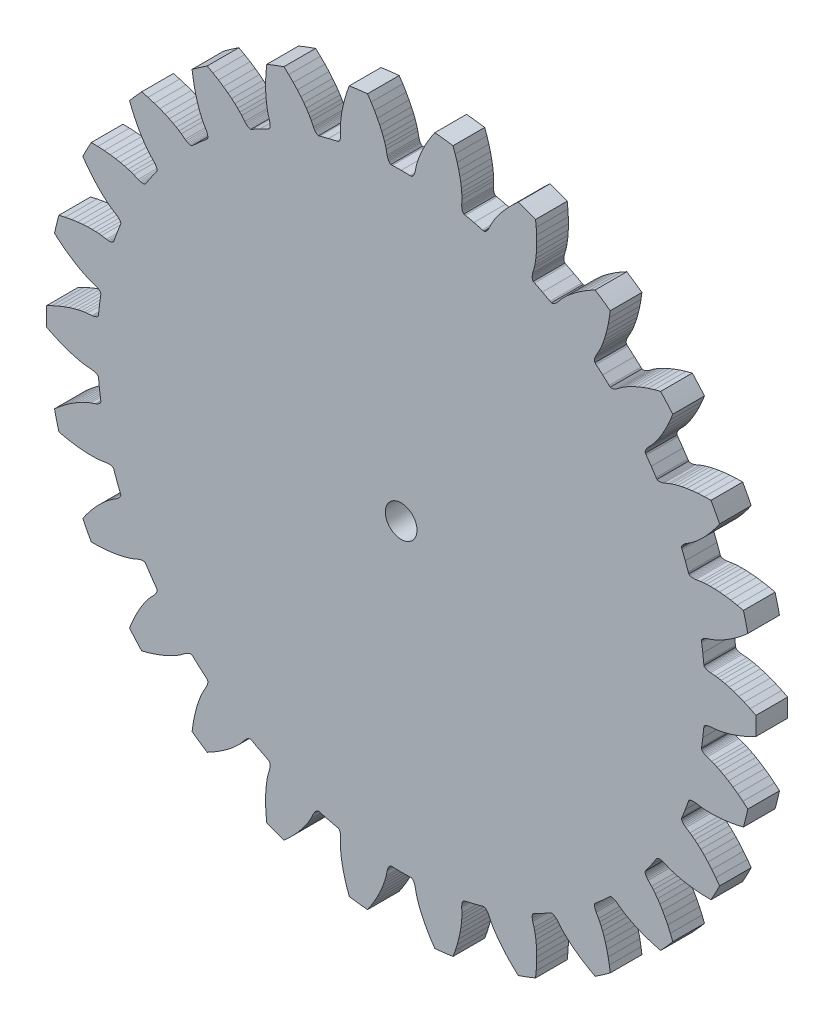
from build123d import *

# Parameters (mm, degrees)
MODEL_R             = 2.5
BOSS_EXTRUDE1_DEPTH = 5


with BuildPart() as part:
    # Model → Boss-Extrude1 (new body)
    with BuildSketch(Plane.XY):
        with BuildLine():
            Line((53.1145369, 10.6909188), (53.9185912, 11.3234084))
            Line((53.9185912, 11.3234084), (54.700837925, 11.992224127))
            ThreePointArc((54.700837925, 11.992224127), (54.372699629, 13.40166681), (54.00825103, 14.802159807))
            Line((54.00825103, 14.802159807), (53.0047917, 15.0308385))
            Line((53.0047917, 15.0308385), (51.9989045, 15.2172176))
            Line((51.9989045, 15.2172176), (51.0709493, 15.3492608))
            Line((51.0709493, 15.3492608), (50.2227788, 15.4339274))
            Line((50.2227788, 15.4339274), (49.4587592, 15.4780067))
            Line((49.4587592, 15.4780067), (48.7788318, 15.48876))
            Line((48.7788318, 15.48876), (48.184081, 15.4732826))
            Line((48.184081, 15.4732826), (47.6758858, 15.4387394))
            Line((47.6758858, 15.4387394), (47.2557344, 15.3924859))
            Line((47.2557344, 15.3924859), (46.5056239, 15.2698861))
            Line((46.5056239, 15.2698861), (46.2943856, 15.2490778))
            Line((46.2943856, 15.2490778), (46.1029098, 15.2433899))
            Line((46.1029098, 15.2433899), (45.9317238, 15.2519957))
            Line((45.9317238, 15.2519957), (45.7813225, 15.2740135))
            Line((45.7813225, 15.2740135), (45.652196, 15.3086023))
            Line((45.652196, 15.3086023), (45.544796, 15.3548533))
            Line((45.544796, 15.3548533), (45.4595411, 15.4118878))
            Line((45.4595411, 15.4118878), (45.3968175, 15.4787721))
            Line((45.3968175, 15.4787721), (45.3570103, 15.5546041))
            Line((45.3570103, 15.5546041), (45.3057091, 15.7038618))
            Line((45.3057091, 15.7038618), (44.8340288, 17.0033043))
            Line((44.8340288, 17.0033043), (44.3253968, 18.2887329))
            Line((44.3253968, 18.2887329), (44.2648202, 18.4344729))
            Line((44.2648202, 18.4344729), (44.2443304, 18.517631))
            Line((44.2443304, 18.517631), (44.2469271, 18.609288))
            Line((44.2469271, 18.609288), (44.2729204, 18.7085134))
            Line((44.2729204, 18.7085134), (44.3226405, 18.8143522))
            Line((44.3226405, 18.8143522), (44.3963564, 18.925869))
            Line((44.3963564, 18.925869), (44.4943329, 19.042084))
            Line((44.4943329, 19.042084), (44.6167607, 19.1620429))
            Line((44.6167607, 19.1620429), (44.7638542, 19.2847575))
            Line((44.7638542, 19.2847575), (44.9357668, 19.4092591))
            Line((44.9357668, 19.4092591), (45.5785313, 19.8149071))
            Line((45.5785313, 19.8149071), (45.9236908, 20.0588977))
            Line((45.9236908, 20.0588977), (46.3269868, 20.3700375))
            Line((46.3269868, 20.3700375), (46.7824276, 20.7528453))
            Line((46.7824276, 20.7528453), (47.2842298, 21.2117694))
            Line((47.2842298, 21.2117694), (47.8268767, 21.751402))
            Line((47.8268767, 21.751402), (48.4055971, 22.3772169))
            Line((48.4055971, 22.3772169), (49.0126207, 23.0914008))
            Line((49.0126207, 23.0914008), (49.6419459, 23.8979342))
            Line((49.6419459, 23.8979342), (50.241403889, 24.734519343))
            ThreePointArc((50.241403889, 24.734519343), (49.585498769, 26.024477381), (48.896480705, 27.297056406))
            Line((48.896480705, 27.297056406), (47.8674537, 27.2789466))
            Line((47.8674537, 27.2789466), (46.8461923, 27.2191853))
            Line((46.8461923, 27.2191853), (45.9136017, 27.1253174))
            Line((45.9136017, 27.1253174), (45.0698155, 27.0045432))
            Line((45.0698155, 27.0045432), (44.3174481, 26.8644998))
            Line((44.3174481, 26.8644998), (43.6547047, 26.7122233))
            Line((43.6547047, 26.7122233), (43.0809402, 26.5548625))
            Line((43.0809402, 26.5548625), (42.595779, 26.3997039))
            Line((42.595779, 26.3997039), (42.1989057, 26.2542458))
            Line((42.1989057, 26.2542458), (41.4999321, 25.9556952))
            Line((41.4999321, 25.9556952), (41.2998117, 25.8849389))
            Line((41.2998117, 25.8849389), (41.115261, 25.8335931))
            Line((41.115261, 25.8335931), (40.9469899, 25.8009814))
            Line((40.9469899, 25.8009814), (40.7956898, 25.786366))
            Line((40.7956898, 25.786366), (40.6620379, 25.7890478))
            Line((40.6620379, 25.7890478), (40.54669, 25.8082523))
            Line((40.54669, 25.8082523), (40.4502632, 25.8432266))
            Line((40.4502632, 25.8432266), (40.3733559, 25.8931567))
            Line((40.3733559, 25.8931567), (40.3165576, 25.9572587))
            Line((40.3165576, 25.9572587), (40.2310274, 26.089902))
            Line((40.2310274, 26.089902), (39.4620764, 27.2387046))
            Line((39.4620764, 27.2387046), (38.660601, 28.3650573))
            Line((38.660601, 28.3650573), (38.5669068, 28.4920654))
            Line((38.5669068, 28.4920654), (38.5271114, 28.5679036))
            Line((38.5271114, 28.5679036), (38.5076977, 28.6575187))
            Line((38.5076977, 28.6575187), (38.5091895, 28.7600814))
            Line((38.5091895, 28.7600814), (38.5321359, 28.8747435))
            Line((38.5321359, 28.8747435), (38.5770221, 29.0006612))
            Line((38.5770221, 29.0006612), (38.6443394, 29.1369465))
            Line((38.6443394, 29.1369465), (38.7345017, 29.2827185))
            Line((38.7345017, 29.2827185), (38.8479534, 29.437069))
            Line((38.8479534, 29.437069), (38.9850754, 29.5990942))
            Line((38.9850754, 29.5990942), (39.5120844, 30.1467784))
            Line((39.5120844, 30.1467784), (39.7888234, 30.4662812))
            Line((39.7888234, 30.4662812), (40.1059397, 30.8648949))
            Line((40.1059397, 30.8648949), (40.4565343, 31.3455731))
            Line((40.4565343, 31.3455731), (40.8339273, 31.9112508))
            Line((40.8339273, 31.9112508), (41.2316633, 32.5650666))
            Line((41.2316633, 32.5650666), (41.6437999, 33.3111933))
            Line((41.6437999, 33.3111933), (42.0622691, 34.1498945))
            Line((42.0622691, 34.1498945), (42.4802912, 35.0835989))
            Line((42.4802912, 35.0835989), (42.86212209, 36.03933398))
            ThreePointArc((42.86212209, 36.03933398), (41.916568958, 37.13483965), (40.943024605, 38.205547261))
            Line((40.943024605, 38.205547261), (39.9482332, 37.9417015))
            Line((39.9482332, 37.9417015), (38.9709496, 37.6392729))
            Line((38.9709496, 37.6392729), (38.0879226, 37.324949))
            Line((38.0879226, 37.324949), (37.2975584, 37.0057531))
            Line((37.2975584, 37.0057531), (36.6005679, 36.6897258))
            Line((36.6005679, 36.6897258), (35.9935249, 36.3832693))
            Line((35.9935249, 36.3832693), (35.4740919, 36.0931703))
            Line((35.4740919, 36.0931703), (35.0401604, 35.8264137))
            Line((35.0401604, 35.8264137), (34.6896299, 35.5902042))
            Line((34.6896299, 35.5902042), (34.082415, 35.1330537))
            Line((34.082415, 35.1330537), (33.9050429, 35.0164615))
            Line((33.9050429, 35.0164615), (33.7381428, 34.9224419))
            Line((33.7381428, 34.9224419), (33.5825658, 34.8505079))
            Line((33.5825658, 34.8505079), (33.4391599, 34.8001087))
            Line((33.4391599, 34.8001087), (33.3087498, 34.7707275))
            Line((33.3087498, 34.7707275), (33.1921579, 34.7617694))
            Line((33.1921579, 34.7617694), (33.0901632, 34.772651))
            Line((33.0901632, 34.772651), (33.0035415, 34.8027251))
            Line((33.0035415, 34.8027251), (32.9330531, 34.8513717))
            Line((32.9330531, 34.8513717), (32.8182646, 34.9596919))
            Line((32.8182646, 34.9596919), (31.7967315, 35.8910904))
            Line((31.7967315, 35.8910904), (30.7489917, 36.7929077))
            Line((30.7489917, 36.7929077), (30.627625, 36.8938027))
            Line((30.627625, 36.8938027), (30.5708367, 36.9579135))
            Line((30.5708367, 36.9579135), (30.5305408, 37.0402785))
            Line((30.5305408, 37.0402785), (30.5074444, 37.140218))
            Line((30.5074444, 37.140218), (30.5022836, 37.2570396))
            Line((30.5022836, 37.2570396), (30.5157314, 37.3900403))
            Line((30.5157314, 37.3900403), (30.5484774, 37.5384756))
            Line((30.5484774, 37.5384756), (30.6011342, 37.7015889))
            Line((30.6011342, 37.7015889), (30.6743508, 37.878605))
            Line((30.6743508, 37.878605), (30.7687131, 38.0687375))
            Line((30.7687131, 38.0687375), (31.1493387, 38.7266285))
            Line((31.1493387, 38.7266285), (31.3415742, 39.1030751))
            Line((31.3415742, 39.1030751), (31.5540812, 39.5659967))
            Line((31.5540812, 39.5659967), (31.7794543, 40.1166101))
            Line((31.7794543, 40.1166101), (32.0105054, 40.7561663))
            Line((32.0105054, 40.7561663), (32.2402156, 41.4861678))
            Line((32.2402156, 41.4861678), (32.4618164, 42.3092442))
            Line((32.4618164, 42.3092442), (32.6674113, 43.2237205))
            Line((32.6674113, 43.2237205), (32.8498364, 44.2303324))
            Line((32.8498364, 44.2303324), (32.991849572, 45.249673828))
            ThreePointArc((32.991849572, 45.249673828), (31.81160102, 46.087060609), (30.610108842, 46.893670685))
            Line((30.610108842, 46.893670685), (29.7073667, 46.3994226))
            Line((29.7073667, 46.3994226), (28.8308571, 45.8719027))
            Line((28.8308571, 45.8719027), (28.0487118, 45.3553904))
            Line((28.0487118, 45.3553904), (27.3577028, 44.8563231))
            Line((27.3577028, 44.8563231), (26.7565959, 44.3826783))
            Line((26.7565959, 44.3826783), (26.2405322, 43.9398519))
            Line((26.2405322, 43.9398519), (25.8056182, 43.5338742))
            Line((25.8056182, 43.5338742), (25.448135, 43.1710225))
            Line((25.448135, 43.1710225), (25.1643189, 42.8577894))
            Line((25.1643189, 42.8577894), (24.6841519, 42.2686068))
            Line((24.6841519, 42.2686068), (24.5398362, 42.1129547))
            Line((24.5398362, 42.1129547), (24.4002863, 41.9817252))
            Line((24.4002863, 41.9817252), (24.266445, 41.8746495))
            Line((24.266445, 41.8746495), (24.1392675, 41.7913956))
            Line((24.1392675, 41.7913956), (24.0196783, 41.731659))
            Line((24.0196783, 41.731659), (23.9086182, 41.6950589))
            Line((23.9086182, 41.6950589), (23.8069831, 41.6812154))
            Line((23.8069831, 41.6812154), (23.7156813, 41.6896856))
            Line((23.7156813, 41.6896856), (23.6355993, 41.7200496))
            Line((23.6355993, 41.7200496), (23.4982236, 41.7977516))
            Line((23.4982236, 41.7977516), (22.2834761, 42.4576164))
            Line((22.2834761, 42.4576164), (21.0503627, 43.0824881))
            Line((21.0503627, 43.0824881), (20.908377, 43.1514063))
            Line((20.908377, 43.1514063), (20.8378961, 43.2000638))
            Line((20.8378961, 43.2000638), (20.7790599, 43.270392))
            Line((20.7790599, 43.270392), (20.7327176, 43.3619001))
            Line((20.7327176, 43.3619001), (20.6997495, 43.474092))
            Line((20.6997495, 43.474092), (20.6809774, 43.6064463))
            Line((20.6809774, 43.6064463), (20.677249, 43.7584049))
            Line((20.677249, 43.7584049), (20.6893401, 43.92938))
            Line((20.6893401, 43.92938), (20.7180664, 44.1187742))
            Line((20.7180664, 44.1187742), (20.764185, 44.3259642))
            Line((20.764185, 44.3259642), (20.9763067, 45.0558278))
            Line((20.9763067, 45.0558278), (21.0728666, 45.4673405))
            Line((21.0728666, 45.4673405), (21.1684141, 45.9676667))
            Line((21.1684141, 45.9676667), (21.2554679, 46.5562155))
            Line((21.2554679, 46.5562155), (21.3267493, 47.2324816))
            Line((21.3267493, 47.2324816), (21.3750837, 47.9962438))
            Line((21.3750837, 47.9962438), (21.3932701, 48.8484356))
            Line((21.3932701, 48.8484356), (21.3740423, 49.785541))
            Line((21.3740423, 49.785541), (21.3102684, 50.8065597))
            Line((21.3102684, 50.8065597), (21.20421064, 51.830266876))
            ThreePointArc((21.20421064, 51.830266876), (19.857858064, 52.360868552), (18.498244695, 52.856504393))
            Line((18.498244695, 52.856504393), (17.740016, 52.1605779))
            Line((17.740016, 52.1605779), (17.0152199, 51.4386243))
            Line((17.0152199, 51.4386243), (16.3794118, 50.7499412))
            Line((16.3794118, 50.7499412), (15.8279169, 50.1000067))
            Line((15.8279169, 50.1000067), (15.3576277, 49.4962708))
            Line((15.3576277, 49.4962708), (14.9625352, 48.9428101))
            Line((14.9625352, 48.9428101), (14.6374158, 48.4445476))
            Line((14.6374158, 48.4445476), (14.3771566, 48.0066883))
            Line((14.3771566, 48.0066883), (14.1765492, 47.6346356))
            Line((14.1765492, 47.6346356), (13.8513356, 46.9476622))
            Line((13.8513356, 46.9476622), (13.7484635, 46.7619959))
            Line((13.7484635, 46.7619959), (13.6443738, 46.6011833))
            Line((13.6443738, 46.6011833), (13.5400466, 46.4651887))
            Line((13.5400466, 46.4651887), (13.4364887, 46.3539184))
            Line((13.4364887, 46.3539184), (13.3346705, 46.2672981))
            Line((13.3346705, 46.2672981), (13.2355965, 46.2051831))
            Line((13.2355965, 46.2051831), (13.1402277, 46.167419))
            Line((13.1402277, 46.167419), (13.0495519, 46.1537932))
            Line((13.0495519, 46.1537932), (12.9645303, 46.1641099))
            Line((12.9645303, 46.1641099), (12.8125513, 46.2066779))
            Line((12.8125513, 46.2066779), (11.4751861, 46.5566601))
            Line((11.4751861, 46.5566601), (10.1283632, 46.8682708))
            Line((10.1283632, 46.8682708), (9.9740101, 46.901207))
            Line((9.9740101, 46.901207), (9.8939328, 46.9315834))
            Line((9.8939328, 46.9315834), (9.8199756, 46.9857876))
            Line((9.8199756, 46.9857876), (9.7530806, 47.0635462))
            Line((9.7530806, 47.0635462), (9.6942212, 47.1645882))
            Line((9.6942212, 47.1645882), (9.6443201, 47.288604))
            Line((9.6443201, 47.288604), (9.604334, 47.4352547))
            Line((9.604334, 47.4352547), (9.5751567, 47.6041553))
            Line((9.5751567, 47.6041553), (9.5577233, 47.7949206))
            Line((9.5577233, 47.7949206), (9.5529179, 48.007127))
            Line((9.5529179, 48.007127), (9.584208, 48.7665461))
            Line((9.584208, 48.7665461), (9.5794806, 49.1892093))
            Line((9.5794806, 49.1892093), (9.5525158, 49.6978629))
            Line((9.5525158, 49.6978629), (9.496191, 50.2901429))
            Line((9.496191, 50.2901429), (9.40356, 50.9638167))
            Line((9.40356, 50.9638167), (9.2677097, 51.7169526))
            Line((9.2677097, 51.7169526), (9.0814248, 52.5487335))
            Line((9.0814248, 52.5487335), (8.8384916, 53.4540068))
            Line((8.8384916, 53.4540068), (8.5322252, 54.4300945))
            Line((8.5322252, 54.4300945), (8.184260089, 55.398673248))
            ThreePointArc((8.184260089, 55.398673248), (6.750048811, 55.591653611), (5.311329885, 55.747510147))
            Line((5.311329885, 55.747510147), (4.74168, 54.89035))
            Line((4.74168, 54.89035), (4.21072, 54.01592))
            Line((4.21072, 54.01592), (3.7582, 53.19509))
            Line((3.7582, 53.19509), (3.37827, 52.43206))
            Line((3.37827, 52.43206), (3.06613, 51.73332))
            Line((3.06613, 51.73332), (2.81497, 51.10139))
            Line((2.81497, 51.10139), (2.61854, 50.5398))
            Line((2.61854, 50.5398), (2.47063, 50.05238))
            Line((2.47063, 50.05238), (2.36489, 49.64313))
            Line((2.36489, 49.64313), (2.21353, 48.89829))
            Line((2.21353, 48.89829), (2.15808, 48.6934))
            Line((2.15808, 48.6934), (2.0955, 48.51235))
            Line((2.0955, 48.51235), (2.02675, 48.35534))
            Line((2.02675, 48.35534), (1.95283, 48.22252))
            Line((1.95283, 48.22252), (1.8747, 48.11405))
            Line((1.8747, 48.11405), (1.79337, 48.03003))
            Line((1.79337, 48.03003), (1.70981, 47.97054))
            Line((1.70981, 47.97054), (1.62503, 47.93561))
            Line((1.62503, 47.93561), (1.54001, 47.92528))
            Line((1.54001, 47.92528), (1.38226, 47.93024))
            Line((1.38226, 47.93024), (0, 47.95))
            Line((0, 47.95), (-1.38226, 47.93024))
            Line((-1.38226, 47.93024), (-1.54001, 47.92528))
            Line((-1.54001, 47.92528), (-1.62503, 47.93561))
            Line((-1.62503, 47.93561), (-1.70981, 47.97054))
            Line((-1.70981, 47.97054), (-1.79337, 48.03003))
            Line((-1.79337, 48.03003), (-1.8747, 48.11405))
            Line((-1.8747, 48.11405), (-1.95283, 48.22252))
            Line((-1.95283, 48.22252), (-2.02675, 48.35534))
            Line((-2.02675, 48.35534), (-2.0955, 48.51235))
            Line((-2.0955, 48.51235), (-2.15808, 48.6934))
            Line((-2.15808, 48.6934), (-2.21353, 48.89829))
            Line((-2.21353, 48.89829), (-2.36489, 49.64313))
            Line((-2.36489, 49.64313), (-2.47063, 50.05238))
            Line((-2.47063, 50.05238), (-2.61854, 50.5398))
            Line((-2.61854, 50.5398), (-2.81497, 51.10139))
            Line((-2.81497, 51.10139), (-3.06613, 51.73332))
            Line((-3.06613, 51.73332), (-3.37827, 52.43206))
            Line((-3.37827, 52.43206), (-3.7582, 53.19509))
            Line((-3.7582, 53.19509), (-4.21072, 54.01592))
            Line((-4.21072, 54.01592), (-4.74168, 54.89035))
            Line((-4.74168, 54.89035), (-5.311329885, 55.747510247))
            ThreePointArc((-5.311329885, 55.747510247), (-6.750048811, 55.591653711), (-8.184260089, 55.398673348))
            Line((-8.184260089, 55.398673348), (-8.5322252, 54.4300945))
            Line((-8.5322252, 54.4300945), (-8.8384916, 53.4540068))
            Line((-8.8384916, 53.4540068), (-9.0814248, 52.5487335))
            Line((-9.0814248, 52.5487335), (-9.2677097, 51.7169526))
            Line((-9.2677097, 51.7169526), (-9.40356, 50.9638167))
            Line((-9.40356, 50.9638167), (-9.496191, 50.2901429))
            Line((-9.496191, 50.2901429), (-9.5525158, 49.6978629))
            Line((-9.5525158, 49.6978629), (-9.5794806, 49.1892093))
            Line((-9.5794806, 49.1892093), (-9.584208, 48.7665461))
            Line((-9.584208, 48.7665461), (-9.5529179, 48.007127))
            Line((-9.5529179, 48.007127), (-9.5577233, 47.7949206))
            Line((-9.5577233, 47.7949206), (-9.5751567, 47.6041553))
            Line((-9.5751567, 47.6041553), (-9.604334, 47.4352547))
            Line((-9.604334, 47.4352547), (-9.6443201, 47.288604))
            Line((-9.6443201, 47.288604), (-9.6942212, 47.1645882))
            Line((-9.6942212, 47.1645882), (-9.7530806, 47.0635462))
            Line((-9.7530806, 47.0635462), (-9.8199756, 46.9857876))
            Line((-9.8199756, 46.9857876), (-9.8939328, 46.9315834))
            Line((-9.8939328, 46.9315834), (-9.9740101, 46.901207))
            Line((-9.9740101, 46.901207), (-10.1283632, 46.8682708))
            Line((-10.1283632, 46.8682708), (-11.4751861, 46.5566601))
            Line((-11.4751861, 46.5566601), (-12.8125513, 46.2066779))
            Line((-12.8125513, 46.2066779), (-12.9645303, 46.1641099))
            Line((-12.9645303, 46.1641099), (-13.0495519, 46.1537932))
            Line((-13.0495519, 46.1537932), (-13.1402277, 46.167419))
            Line((-13.1402277, 46.167419), (-13.2355965, 46.2051831))
            Line((-13.2355965, 46.2051831), (-13.3346705, 46.2672981))
            Line((-13.3346705, 46.2672981), (-13.4364887, 46.3539184))
            Line((-13.4364887, 46.3539184), (-13.5400466, 46.4651887))
            Line((-13.5400466, 46.4651887), (-13.6443738, 46.6011833))
            Line((-13.6443738, 46.6011833), (-13.7484635, 46.7619959))
            Line((-13.7484635, 46.7619959), (-13.8513356, 46.9476622))
            Line((-13.8513356, 46.9476622), (-14.1765492, 47.6346356))
            Line((-14.1765492, 47.6346356), (-14.3771566, 48.0066883))
            Line((-14.3771566, 48.0066883), (-14.6374158, 48.4445476))
            Line((-14.6374158, 48.4445476), (-14.9625352, 48.9428101))
            Line((-14.9625352, 48.9428101), (-15.3576277, 49.4962708))
            Line((-15.3576277, 49.4962708), (-15.8279169, 50.1000067))
            Line((-15.8279169, 50.1000067), (-16.3794118, 50.7499412))
            Line((-16.3794118, 50.7499412), (-17.0152199, 51.4386243))
            Line((-17.0152199, 51.4386243), (-17.740016, 52.1605779))
            Line((-17.740016, 52.1605779), (-18.498244795, 52.856504393))
            ThreePointArc((-18.498244795, 52.856504393), (-19.857858172, 52.360868572), (-21.20421074, 51.830266876))
            Line((-21.20421074, 51.830266876), (-21.3102684, 50.8065597))
            Line((-21.3102684, 50.8065597), (-21.3740423, 49.785541))
            Line((-21.3740423, 49.785541), (-21.3932701, 48.8484356))
            Line((-21.3932701, 48.8484356), (-21.3750837, 47.9962438))
            Line((-21.3750837, 47.9962438), (-21.3267493, 47.2324816))
            Line((-21.3267493, 47.2324816), (-21.2554679, 46.5562155))
            Line((-21.2554679, 46.5562155), (-21.1684141, 45.9676667))
            Line((-21.1684141, 45.9676667), (-21.0728666, 45.4673405))
            Line((-21.0728666, 45.4673405), (-20.9763067, 45.0558278))
            Line((-20.9763067, 45.0558278), (-20.764185, 44.3259642))
            Line((-20.764185, 44.3259642), (-20.7180664, 44.1187742))
            Line((-20.7180664, 44.1187742), (-20.6893401, 43.92938))
            Line((-20.6893401, 43.92938), (-20.677249, 43.7584049))
            Line((-20.677249, 43.7584049), (-20.6809774, 43.6064463))
            Line((-20.6809774, 43.6064463), (-20.6997495, 43.474092))
            Line((-20.6997495, 43.474092), (-20.7327176, 43.3619001))
            Line((-20.7327176, 43.3619001), (-20.7790599, 43.270392))
            Line((-20.7790599, 43.270392), (-20.8378961, 43.2000638))
            Line((-20.8378961, 43.2000638), (-20.908377, 43.1514063))
            Line((-20.908377, 43.1514063), (-21.0503627, 43.0824881))
            Line((-21.0503627, 43.0824881), (-22.2834761, 42.4576164))
            Line((-22.2834761, 42.4576164), (-23.4982236, 41.7977516))
            Line((-23.4982236, 41.7977516), (-23.6355993, 41.7200496))
            Line((-23.6355993, 41.7200496), (-23.7156813, 41.6896856))
            Line((-23.7156813, 41.6896856), (-23.8069831, 41.6812154))
            Line((-23.8069831, 41.6812154), (-23.9086182, 41.6950589))
            Line((-23.9086182, 41.6950589), (-24.0196783, 41.731659))
            Line((-24.0196783, 41.731659), (-24.1392675, 41.7913956))
            Line((-24.1392675, 41.7913956), (-24.266445, 41.8746495))
            Line((-24.266445, 41.8746495), (-24.4002863, 41.9817252))
            Line((-24.4002863, 41.9817252), (-24.5398362, 42.1129547))
            Line((-24.5398362, 42.1129547), (-24.6841519, 42.2686068))
            Line((-24.6841519, 42.2686068), (-25.1643189, 42.8577894))
            Line((-25.1643189, 42.8577894), (-25.448135, 43.1710225))
            Line((-25.448135, 43.1710225), (-25.8056182, 43.5338742))
            Line((-25.8056182, 43.5338742), (-26.2405322, 43.9398519))
            Line((-26.2405322, 43.9398519), (-26.7565959, 44.3826783))
            Line((-26.7565959, 44.3826783), (-27.3577028, 44.8563231))
            Line((-27.3577028, 44.8563231), (-28.0487118, 45.3553904))
            Line((-28.0487118, 45.3553904), (-28.8308571, 45.8719027))
            Line((-28.8308571, 45.8719027), (-29.7073667, 46.3994226))
            Line((-29.7073667, 46.3994226), (-30.610108778, 46.893670592))
            ThreePointArc((-30.610108778, 46.893670592), (-31.811600999, 46.087060493), (-32.991849593, 45.249673686))
            Line((-32.991849593, 45.249673686), (-32.8498364, 44.2303324))
            Line((-32.8498364, 44.2303324), (-32.6674113, 43.2237205))
            Line((-32.6674113, 43.2237205), (-32.4618164, 42.3092442))
            Line((-32.4618164, 42.3092442), (-32.2402156, 41.4861678))
            Line((-32.2402156, 41.4861678), (-32.0105054, 40.7561663))
            Line((-32.0105054, 40.7561663), (-31.7794543, 40.1166101))
            Line((-31.7794543, 40.1166101), (-31.5540812, 39.5659967))
            Line((-31.5540812, 39.5659967), (-31.3415742, 39.1030751))
            Line((-31.3415742, 39.1030751), (-31.1493387, 38.7266285))
            Line((-31.1493387, 38.7266285), (-30.7687131, 38.0687375))
            Line((-30.7687131, 38.0687375), (-30.6743508, 37.878605))
            Line((-30.6743508, 37.878605), (-30.6011342, 37.7015889))
            Line((-30.6011342, 37.7015889), (-30.5484774, 37.5384756))
            Line((-30.5484774, 37.5384756), (-30.5157314, 37.3900403))
            Line((-30.5157314, 37.3900403), (-30.5022836, 37.2570396))
            Line((-30.5022836, 37.2570396), (-30.5074444, 37.140218))
            Line((-30.5074444, 37.140218), (-30.5305408, 37.0402785))
            Line((-30.5305408, 37.0402785), (-30.5708367, 36.9579135))
            Line((-30.5708367, 36.9579135), (-30.627625, 36.8938027))
            Line((-30.627625, 36.8938027), (-30.7489917, 36.7929077))
            Line((-30.7489917, 36.7929077), (-31.7967315, 35.8910904))
            Line((-31.7967315, 35.8910904), (-32.8182646, 34.9596919))
            Line((-32.8182646, 34.9596919), (-32.9330531, 34.8513717))
            Line((-32.9330531, 34.8513717), (-33.0035415, 34.8027251))
            Line((-33.0035415, 34.8027251), (-33.0901632, 34.772651))
            Line((-33.0901632, 34.772651), (-33.1921579, 34.7617694))
            Line((-33.1921579, 34.7617694), (-33.3087498, 34.7707275))
            Line((-33.3087498, 34.7707275), (-33.4391599, 34.8001087))
            Line((-33.4391599, 34.8001087), (-33.5825658, 34.8505079))
            Line((-33.5825658, 34.8505079), (-33.7381428, 34.9224419))
            Line((-33.7381428, 34.9224419), (-33.9050429, 35.0164615))
            Line((-33.9050429, 35.0164615), (-34.082415, 35.1330537))
            Line((-34.082415, 35.1330537), (-34.6896299, 35.5902042))
            Line((-34.6896299, 35.5902042), (-35.0401604, 35.8264137))
            Line((-35.0401604, 35.8264137), (-35.4740919, 36.0931703))
            Line((-35.4740919, 36.0931703), (-35.9935249, 36.3832693))
            Line((-35.9935249, 36.3832693), (-36.6005679, 36.6897258))
            Line((-36.6005679, 36.6897258), (-37.2975584, 37.0057531))
            Line((-37.2975584, 37.0057531), (-38.0879226, 37.324949))
            Line((-38.0879226, 37.324949), (-38.9709496, 37.6392729))
            Line((-38.9709496, 37.6392729), (-39.9482332, 37.9417015))
            Line((-39.9482332, 37.9417015), (-40.943024605, 38.205547461))
            ThreePointArc((-40.943024605, 38.205547461), (-41.916569017, 37.134839837), (-42.862122153, 36.039334105))
            Line((-42.862122153, 36.039334105), (-42.4802912, 35.0835989))
            Line((-42.4802912, 35.0835989), (-42.0622691, 34.1498945))
            Line((-42.0622691, 34.1498945), (-41.6437999, 33.3111933))
            Line((-41.6437999, 33.3111933), (-41.2316633, 32.5650666))
            Line((-41.2316633, 32.5650666), (-40.8339273, 31.9112508))
            Line((-40.8339273, 31.9112508), (-40.4565343, 31.3455731))
            Line((-40.4565343, 31.3455731), (-40.1059397, 30.8648949))
            Line((-40.1059397, 30.8648949), (-39.7888234, 30.4662812))
            Line((-39.7888234, 30.4662812), (-39.5120844, 30.1467784))
            Line((-39.5120844, 30.1467784), (-38.9850754, 29.5990942))
            Line((-38.9850754, 29.5990942), (-38.8479534, 29.437069))
            Line((-38.8479534, 29.437069), (-38.7345017, 29.2827185))
            Line((-38.7345017, 29.2827185), (-38.6443394, 29.1369465))
            Line((-38.6443394, 29.1369465), (-38.5770221, 29.0006612))
            Line((-38.5770221, 29.0006612), (-38.5321359, 28.8747435))
            Line((-38.5321359, 28.8747435), (-38.5091895, 28.7600814))
            Line((-38.5091895, 28.7600814), (-38.5076977, 28.6575187))
            Line((-38.5076977, 28.6575187), (-38.5271114, 28.5679036))
            Line((-38.5271114, 28.5679036), (-38.5669068, 28.4920654))
            Line((-38.5669068, 28.4920654), (-38.660601, 28.3650573))
            Line((-38.660601, 28.3650573), (-39.4620764, 27.2387046))
            Line((-39.4620764, 27.2387046), (-40.2310274, 26.089902))
            Line((-40.2310274, 26.089902), (-40.3165576, 25.9572587))
            Line((-40.3165576, 25.9572587), (-40.3733559, 25.8931567))
            Line((-40.3733559, 25.8931567), (-40.4502632, 25.8432266))
            Line((-40.4502632, 25.8432266), (-40.54669, 25.8082523))
            Line((-40.54669, 25.8082523), (-40.6620379, 25.7890478))
            Line((-40.6620379, 25.7890478), (-40.7956898, 25.786366))
            Line((-40.7956898, 25.786366), (-40.9469899, 25.8009814))
            Line((-40.9469899, 25.8009814), (-41.115261, 25.8335931))
            Line((-41.115261, 25.8335931), (-41.2998117, 25.8849389))
            Line((-41.2998117, 25.8849389), (-41.4999321, 25.9556952))
            Line((-41.4999321, 25.9556952), (-42.1989057, 26.2542458))
            Line((-42.1989057, 26.2542458), (-42.595779, 26.3997039))
            Line((-42.595779, 26.3997039), (-43.0809402, 26.5548625))
            Line((-43.0809402, 26.5548625), (-43.6547047, 26.7122233))
            Line((-43.6547047, 26.7122233), (-44.3174481, 26.8644998))
            Line((-44.3174481, 26.8644998), (-45.0698155, 27.0045432))
            Line((-45.0698155, 27.0045432), (-45.9136017, 27.1253174))
            Line((-45.9136017, 27.1253174), (-46.8461923, 27.2191853))
            Line((-46.8461923, 27.2191853), (-47.8674537, 27.2789466))
            Line((-47.8674537, 27.2789466), (-48.896480705, 27.297056406))
            ThreePointArc((-48.896480705, 27.297056406), (-49.585498769, 26.024477381), (-50.241403889, 24.734519343))
            Line((-50.241403889, 24.734519343), (-49.6419459, 23.8979342))
            Line((-49.6419459, 23.8979342), (-49.0126207, 23.0914008))
            Line((-49.0126207, 23.0914008), (-48.4055971, 22.3772169))
            Line((-48.4055971, 22.3772169), (-47.8268767, 21.751402))
            Line((-47.8268767, 21.751402), (-47.2842298, 21.2117694))
            Line((-47.2842298, 21.2117694), (-46.7824276, 20.7528453))
            Line((-46.7824276, 20.7528453), (-46.3269868, 20.3700375))
            Line((-46.3269868, 20.3700375), (-45.9236908, 20.0588977))
            Line((-45.9236908, 20.0588977), (-45.5785313, 19.8149071))
            Line((-45.5785313, 19.8149071), (-44.9357668, 19.4092591))
            Line((-44.9357668, 19.4092591), (-44.7638542, 19.2847575))
            Line((-44.7638542, 19.2847575), (-44.6167607, 19.1620429))
            Line((-44.6167607, 19.1620429), (-44.4943329, 19.042084))
            Line((-44.4943329, 19.042084), (-44.3963564, 18.925869))
            Line((-44.3963564, 18.925869), (-44.3226405, 18.8143522))
            Line((-44.3226405, 18.8143522), (-44.2729204, 18.7085134))
            Line((-44.2729204, 18.7085134), (-44.2469271, 18.609288))
            Line((-44.2469271, 18.609288), (-44.2443304, 18.517631))
            Line((-44.2443304, 18.517631), (-44.2648202, 18.4344729))
            Line((-44.2648202, 18.4344729), (-44.3253968, 18.2887329))
            Line((-44.3253968, 18.2887329), (-44.8340288, 17.0033043))
            Line((-44.8340288, 17.0033043), (-45.3057091, 15.7038618))
            Line((-45.3057091, 15.7038618), (-45.3570103, 15.5546041))
            Line((-45.3570103, 15.5546041), (-45.3968175, 15.4787721))
            Line((-45.3968175, 15.4787721), (-45.4595411, 15.4118878))
            Line((-45.4595411, 15.4118878), (-45.544796, 15.3548533))
            Line((-45.544796, 15.3548533), (-45.652196, 15.3086023))
            Line((-45.652196, 15.3086023), (-45.7813225, 15.2740135))
            Line((-45.7813225, 15.2740135), (-45.9317238, 15.2519957))
            Line((-45.9317238, 15.2519957), (-46.1029098, 15.2433899))
            Line((-46.1029098, 15.2433899), (-46.2943856, 15.2490778))
            Line((-46.2943856, 15.2490778), (-46.5056239, 15.2698861))
            Line((-46.5056239, 15.2698861), (-47.2557344, 15.3924859))
            Line((-47.2557344, 15.3924859), (-47.6758858, 15.4387394))
            Line((-47.6758858, 15.4387394), (-48.184081, 15.4732826))
            Line((-48.184081, 15.4732826), (-48.7788318, 15.48876))
            Line((-48.7788318, 15.48876), (-49.4587592, 15.4780067))
            Line((-49.4587592, 15.4780067), (-50.2227788, 15.4339274))
            Line((-50.2227788, 15.4339274), (-51.0709493, 15.3492608))
            Line((-51.0709493, 15.3492608), (-51.9989045, 15.2172176))
            Line((-51.9989045, 15.2172176), (-53.0047917, 15.0308385))
            Line((-53.0047917, 15.0308385), (-54.00825113, 14.802159807))
            ThreePointArc((-54.00825113, 14.802159807), (-54.372699485, 13.40166675), (-54.700838025, 11.992224127))
            Line((-54.700838025, 11.992224127), (-53.9185912, 11.3234084))
            Line((-53.9185912, 11.3234084), (-53.1145369, 10.6909188))
            Line((-53.1145369, 10.6909188), (-52.3542369, 10.142758))
            Line((-52.3542369, 10.142758), (-51.6425658, 9.6736251))
            Line((-51.6425658, 9.6736251), (-50.9865447, 9.2795371))
            Line((-50.9865447, 9.2795371), (-50.3894962, 8.9540376))
            Line((-50.3894962, 8.9540376), (-49.8556778, 8.6913476))
            Line((-49.8556778, 8.6913476), (-49.3896403, 8.485764))
            Line((-49.3896403, 8.485764), (-48.9961197, 8.3314654))
            Line((-48.9961197, 8.3314654), (-48.2749549, 8.0914284))
            Line((-48.2749549, 8.0914284), (-48.0782425, 8.011686))
            Line((-48.0782425, 8.011686), (-47.9060557, 7.9277391))
            Line((-47.9060557, 7.9277391), (-47.7584774, 7.8405649))
            Line((-47.7584774, 7.8405649), (-47.6355359, 7.7511741))
            Line((-47.6355359, 7.7511741), (-47.5372743, 7.6605392))
            Line((-47.5372743, 7.6605392), (-47.4636701, 7.5696747))
            Line((-47.4636701, 7.5696747), (-47.4146859, 7.4795532))
            Line((-47.4146859, 7.4795532), (-47.3902297, 7.391181))
            Line((-47.3902297, 7.391181), (-47.3902231, 7.3055357))
            Line((-47.3902231, 7.3055357), (-47.4141616, 7.1495338))
            Line((-47.4141616, 7.1495338), (-47.6003905, 5.7797338))
            Line((-47.6003905, 5.7797338), (-47.7473876, 4.4051702))
            Line((-47.7473876, 4.4051702), (-47.7614784, 4.2479726))
            Line((-47.7614784, 4.2479726), (-47.7819812, 4.1648176))
            Line((-47.7819812, 4.1648176), (-47.8268756, 4.0848661))
            Line((-47.8268756, 4.0848661), (-47.8960039, 4.0090861))
            Line((-47.8960039, 4.0090861), (-47.9892145, 3.9384765))
            Line((-47.9892145, 3.9384765), (-48.1063112, 3.8739908))
            Line((-48.1063112, 3.8739908), (-48.2470728, 3.8166194))
            Line((-48.2470728, 3.8166194), (-48.411225, 3.7672962))
            Line((-48.411225, 3.7672962), (-48.5984981, 3.7269956))
            Line((-48.5984981, 3.7269956), (-48.808578, 3.6966467))
            Line((-48.808578, 3.6966467), (-49.5662317, 3.6361708))
            Line((-49.5662317, 3.6361708), (-49.9852433, 3.5805314))
            Line((-49.9852433, 3.5805314), (-50.4869381, 3.4924518))
            Line((-50.4869381, 3.4924518), (-51.0681105, 3.3651462))
            Line((-51.0681105, 3.3651462), (-51.725707, 3.1919882))
            Line((-51.725707, 3.1919882), (-52.4569767, 2.9663478))
            Line((-52.4569767, 2.9663478), (-53.2602389, 2.6811611))
            Line((-53.2602389, 2.6811611), (-54.1296293, 2.3308806))
            Line((-54.1296293, 2.3308806), (-55.0616839, 1.9091928))
            Line((-55.0616839, 1.9091928), (-55.981258057, 1.447015426))
            ThreePointArc((-55.981258057, 1.447015426), (-55.999956052, -4.9e-08), (-55.981258054, -1.447015524))
            Line((-55.981258054, -1.447015524), (-55.0616839, -1.9091928))
            Line((-55.0616839, -1.9091928), (-54.1296293, -2.3308806))
            Line((-54.1296293, -2.3308806), (-53.2602389, -2.6811611))
            Line((-53.2602389, -2.6811611), (-52.4569767, -2.9663478))
            Line((-52.4569767, -2.9663478), (-51.725707, -3.1919882))
            Line((-51.725707, -3.1919882), (-51.0681105, -3.3651462))
            Line((-51.0681105, -3.3651462), (-50.4869381, -3.4924518))
            Line((-50.4869381, -3.4924518), (-49.9852433, -3.5805314))
            Line((-49.9852433, -3.5805314), (-49.5662317, -3.6361708))
            Line((-49.5662317, -3.6361708), (-48.808578, -3.6966467))
            Line((-48.808578, -3.6966467), (-48.5984981, -3.7269956))
            Line((-48.5984981, -3.7269956), (-48.411225, -3.7672962))
            Line((-48.411225, -3.7672962), (-48.2470728, -3.8166194))
            Line((-48.2470728, -3.8166194), (-48.1063112, -3.8739908))
            Line((-48.1063112, -3.8739908), (-47.9892145, -3.9384765))
            Line((-47.9892145, -3.9384765), (-47.8960039, -4.0090861))
            Line((-47.8960039, -4.0090861), (-47.8268756, -4.0848661))
            Line((-47.8268756, -4.0848661), (-47.7819812, -4.1648176))
            Line((-47.7819812, -4.1648176), (-47.7614784, -4.2479726))
            Line((-47.7614784, -4.2479726), (-47.7473876, -4.4051702))
            Line((-47.7473876, -4.4051702), (-47.6003905, -5.7797338))
            Line((-47.6003905, -5.7797338), (-47.4141616, -7.1495338))
            Line((-47.4141616, -7.1495338), (-47.3902231, -7.3055357))
            Line((-47.3902231, -7.3055357), (-47.3902297, -7.391181))
            Line((-47.3902297, -7.391181), (-47.4146859, -7.4795532))
            Line((-47.4146859, -7.4795532), (-47.4636701, -7.5696747))
            Line((-47.4636701, -7.5696747), (-47.5372743, -7.6605392))
            Line((-47.5372743, -7.6605392), (-47.6355359, -7.7511741))
            Line((-47.6355359, -7.7511741), (-47.7584774, -7.8405649))
            Line((-47.7584774, -7.8405649), (-47.9060557, -7.9277391))
            Line((-47.9060557, -7.9277391), (-48.0782425, -8.011686))
            Line((-48.0782425, -8.011686), (-48.2749549, -8.0914284))
            Line((-48.2749549, -8.0914284), (-48.9961197, -8.3314654))
            Line((-48.9961197, -8.3314654), (-49.3896403, -8.485764))
            Line((-49.3896403, -8.485764), (-49.8556778, -8.6913476))
            Line((-49.8556778, -8.6913476), (-50.3894962, -8.9540376))
            Line((-50.3894962, -8.9540376), (-50.9865447, -9.2795371))
            Line((-50.9865447, -9.2795371), (-51.6425658, -9.6736251))
            Line((-51.6425658, -9.6736251), (-52.3542369, -10.142758))
            Line((-52.3542369, -10.142758), (-53.1145369, -10.6909188))
            Line((-53.1145369, -10.6909188), (-53.9185912, -11.3234084))
            Line((-53.9185912, -11.3234084), (-54.700837925, -11.992224127))
            ThreePointArc((-54.700837925, -11.992224127), (-54.372699385, -13.40166675), (-54.00825103, -14.802159807))
            Line((-54.00825103, -14.802159807), (-53.0047917, -15.0308385))
            Line((-53.0047917, -15.0308385), (-51.9989045, -15.2172176))
            Line((-51.9989045, -15.2172176), (-51.0709493, -15.3492608))
            Line((-51.0709493, -15.3492608), (-50.2227788, -15.4339274))
            Line((-50.2227788, -15.4339274), (-49.4587592, -15.4780067))
            Line((-49.4587592, -15.4780067), (-48.7788318, -15.48876))
            Line((-48.7788318, -15.48876), (-48.184081, -15.4732826))
            Line((-48.184081, -15.4732826), (-47.6758858, -15.4387394))
            Line((-47.6758858, -15.4387394), (-47.2557344, -15.3924859))
            Line((-47.2557344, -15.3924859), (-46.5056239, -15.2698861))
            Line((-46.5056239, -15.2698861), (-46.2943856, -15.2490778))
            Line((-46.2943856, -15.2490778), (-46.1029098, -15.2433899))
            Line((-46.1029098, -15.2433899), (-45.9317238, -15.2519957))
            Line((-45.9317238, -15.2519957), (-45.7813225, -15.2740135))
            Line((-45.7813225, -15.2740135), (-45.652196, -15.3086023))
            Line((-45.652196, -15.3086023), (-45.544796, -15.3548533))
            Line((-45.544796, -15.3548533), (-45.4595411, -15.4118878))
            Line((-45.4595411, -15.4118878), (-45.3968175, -15.4787721))
            Line((-45.3968175, -15.4787721), (-45.3570103, -15.5546041))
            Line((-45.3570103, -15.5546041), (-45.3057091, -15.7038618))
            Line((-45.3057091, -15.7038618), (-44.8340288, -17.0033043))
            Line((-44.8340288, -17.0033043), (-44.3253968, -18.2887329))
            Line((-44.3253968, -18.2887329), (-44.2648202, -18.4344729))
            Line((-44.2648202, -18.4344729), (-44.2443304, -18.517631))
            Line((-44.2443304, -18.517631), (-44.2469271, -18.609288))
            Line((-44.2469271, -18.609288), (-44.2729204, -18.7085134))
            Line((-44.2729204, -18.7085134), (-44.3226405, -18.8143522))
            Line((-44.3226405, -18.8143522), (-44.3963564, -18.925869))
            Line((-44.3963564, -18.925869), (-44.4943329, -19.042084))
            Line((-44.4943329, -19.042084), (-44.6167607, -19.1620429))
            Line((-44.6167607, -19.1620429), (-44.7638542, -19.2847575))
            Line((-44.7638542, -19.2847575), (-44.9357668, -19.4092591))
            Line((-44.9357668, -19.4092591), (-45.5785313, -19.8149071))
            Line((-45.5785313, -19.8149071), (-45.9236908, -20.0588977))
            Line((-45.9236908, -20.0588977), (-46.3269868, -20.3700375))
            Line((-46.3269868, -20.3700375), (-46.7824276, -20.7528453))
            Line((-46.7824276, -20.7528453), (-47.2842298, -21.2117694))
            Line((-47.2842298, -21.2117694), (-47.8268767, -21.751402))
            Line((-47.8268767, -21.751402), (-48.4055971, -22.3772169))
            Line((-48.4055971, -22.3772169), (-49.0126207, -23.0914008))
            Line((-49.0126207, -23.0914008), (-49.6419459, -23.8979342))
            Line((-49.6419459, -23.8979342), (-50.241403889, -24.734519343))
            ThreePointArc((-50.241403889, -24.734519343), (-49.585498769, -26.024477381), (-48.896480705, -27.297056406))
            Line((-48.896480705, -27.297056406), (-47.8674537, -27.2789466))
            Line((-47.8674537, -27.2789466), (-46.8461923, -27.2191853))
            Line((-46.8461923, -27.2191853), (-45.9136017, -27.1253174))
            Line((-45.9136017, -27.1253174), (-45.0698155, -27.0045432))
            Line((-45.0698155, -27.0045432), (-44.3174481, -26.8644998))
            Line((-44.3174481, -26.8644998), (-43.6547047, -26.7122233))
            Line((-43.6547047, -26.7122233), (-43.0809402, -26.5548625))
            Line((-43.0809402, -26.5548625), (-42.595779, -26.3997039))
            Line((-42.595779, -26.3997039), (-42.1989057, -26.2542458))
            Line((-42.1989057, -26.2542458), (-41.4999321, -25.9556952))
            Line((-41.4999321, -25.9556952), (-41.2998117, -25.8849389))
            Line((-41.2998117, -25.8849389), (-41.115261, -25.8335931))
            Line((-41.115261, -25.8335931), (-40.9469899, -25.8009814))
            Line((-40.9469899, -25.8009814), (-40.7956898, -25.786366))
            Line((-40.7956898, -25.786366), (-40.6620379, -25.7890478))
            Line((-40.6620379, -25.7890478), (-40.54669, -25.8082523))
            Line((-40.54669, -25.8082523), (-40.4502632, -25.8432266))
            Line((-40.4502632, -25.8432266), (-40.3733559, -25.8931567))
            Line((-40.3733559, -25.8931567), (-40.3165576, -25.9572587))
            Line((-40.3165576, -25.9572587), (-40.2310274, -26.089902))
            Line((-40.2310274, -26.089902), (-39.4620764, -27.2387046))
            Line((-39.4620764, -27.2387046), (-38.660601, -28.3650573))
            Line((-38.660601, -28.3650573), (-38.5669068, -28.4920654))
            Line((-38.5669068, -28.4920654), (-38.5271114, -28.5679036))
            Line((-38.5271114, -28.5679036), (-38.5076977, -28.6575187))
            Line((-38.5076977, -28.6575187), (-38.5091895, -28.7600814))
            Line((-38.5091895, -28.7600814), (-38.5321359, -28.8747435))
            Line((-38.5321359, -28.8747435), (-38.5770221, -29.0006612))
            Line((-38.5770221, -29.0006612), (-38.6443394, -29.1369465))
            Line((-38.6443394, -29.1369465), (-38.7345017, -29.2827185))
            Line((-38.7345017, -29.2827185), (-38.8479534, -29.437069))
            Line((-38.8479534, -29.437069), (-38.9850754, -29.5990942))
            Line((-38.9850754, -29.5990942), (-39.5120844, -30.1467784))
            Line((-39.5120844, -30.1467784), (-39.7888234, -30.4662812))
            Line((-39.7888234, -30.4662812), (-40.1059397, -30.8648949))
            Line((-40.1059397, -30.8648949), (-40.4565343, -31.3455731))
            Line((-40.4565343, -31.3455731), (-40.8339273, -31.9112508))
            Line((-40.8339273, -31.9112508), (-41.2316633, -32.5650666))
            Line((-41.2316633, -32.5650666), (-41.6437999, -33.3111933))
            Line((-41.6437999, -33.3111933), (-42.0622691, -34.1498945))
            Line((-42.0622691, -34.1498945), (-42.4802912, -35.0835989))
            Line((-42.4802912, -35.0835989), (-42.86212209, -36.03933398))
            ThreePointArc((-42.86212209, -36.03933398), (-41.916568958, -37.13483965), (-40.943024605, -38.205547261))
            Line((-40.943024605, -38.205547261), (-39.9482332, -37.9417015))
            Line((-39.9482332, -37.9417015), (-38.9709496, -37.6392729))
            Line((-38.9709496, -37.6392729), (-38.0879226, -37.324949))
            Line((-38.0879226, -37.324949), (-37.2975584, -37.0057531))
            Line((-37.2975584, -37.0057531), (-36.6005679, -36.6897258))
            Line((-36.6005679, -36.6897258), (-35.9935249, -36.3832693))
            Line((-35.9935249, -36.3832693), (-35.4740919, -36.0931703))
            Line((-35.4740919, -36.0931703), (-35.0401604, -35.8264137))
            Line((-35.0401604, -35.8264137), (-34.6896299, -35.5902042))
            Line((-34.6896299, -35.5902042), (-34.082415, -35.1330537))
            Line((-34.082415, -35.1330537), (-33.9050429, -35.0164615))
            Line((-33.9050429, -35.0164615), (-33.7381428, -34.9224419))
            Line((-33.7381428, -34.9224419), (-33.5825658, -34.8505079))
            Line((-33.5825658, -34.8505079), (-33.4391599, -34.8001087))
            Line((-33.4391599, -34.8001087), (-33.3087498, -34.7707275))
            Line((-33.3087498, -34.7707275), (-33.1921579, -34.7617694))
            Line((-33.1921579, -34.7617694), (-33.0901632, -34.772651))
            Line((-33.0901632, -34.772651), (-33.0035415, -34.8027251))
            Line((-33.0035415, -34.8027251), (-32.9330531, -34.8513717))
            Line((-32.9330531, -34.8513717), (-32.8182646, -34.9596919))
            Line((-32.8182646, -34.9596919), (-31.7967315, -35.8910904))
            Line((-31.7967315, -35.8910904), (-30.7489917, -36.7929077))
            Line((-30.7489917, -36.7929077), (-30.627625, -36.8938027))
            Line((-30.627625, -36.8938027), (-30.5708367, -36.9579135))
            Line((-30.5708367, -36.9579135), (-30.5305408, -37.0402785))
            Line((-30.5305408, -37.0402785), (-30.5074444, -37.140218))
            Line((-30.5074444, -37.140218), (-30.5022836, -37.2570396))
            Line((-30.5022836, -37.2570396), (-30.5157314, -37.3900403))
            Line((-30.5157314, -37.3900403), (-30.5484774, -37.5384756))
            Line((-30.5484774, -37.5384756), (-30.6011342, -37.7015889))
            Line((-30.6011342, -37.7015889), (-30.6743508, -37.878605))
            Line((-30.6743508, -37.878605), (-30.7687131, -38.0687375))
            Line((-30.7687131, -38.0687375), (-31.1493387, -38.7266285))
            Line((-31.1493387, -38.7266285), (-31.3415742, -39.1030751))
            Line((-31.3415742, -39.1030751), (-31.5540812, -39.5659967))
            Line((-31.5540812, -39.5659967), (-31.7794543, -40.1166101))
            Line((-31.7794543, -40.1166101), (-32.0105054, -40.7561663))
            Line((-32.0105054, -40.7561663), (-32.2402156, -41.4861678))
            Line((-32.2402156, -41.4861678), (-32.4618164, -42.3092442))
            Line((-32.4618164, -42.3092442), (-32.6674113, -43.2237205))
            Line((-32.6674113, -43.2237205), (-32.8498364, -44.2303324))
            Line((-32.8498364, -44.2303324), (-32.991849572, -45.249673828))
            ThreePointArc((-32.991849572, -45.249673828), (-31.81160102, -46.087060609), (-30.610108842, -46.893670685))
            Line((-30.610108842, -46.893670685), (-29.7073667, -46.3994226))
            Line((-29.7073667, -46.3994226), (-28.8308571, -45.8719027))
            Line((-28.8308571, -45.8719027), (-28.0487118, -45.3553904))
            Line((-28.0487118, -45.3553904), (-27.3577028, -44.8563231))
            Line((-27.3577028, -44.8563231), (-26.7565959, -44.3826783))
            Line((-26.7565959, -44.3826783), (-26.2405322, -43.9398519))
            Line((-26.2405322, -43.9398519), (-25.8056182, -43.5338742))
            Line((-25.8056182, -43.5338742), (-25.448135, -43.1710225))
            Line((-25.448135, -43.1710225), (-25.1643189, -42.8577894))
            Line((-25.1643189, -42.8577894), (-24.6841519, -42.2686068))
            Line((-24.6841519, -42.2686068), (-24.5398362, -42.1129547))
            Line((-24.5398362, -42.1129547), (-24.4002863, -41.9817252))
            Line((-24.4002863, -41.9817252), (-24.266445, -41.8746495))
            Line((-24.266445, -41.8746495), (-24.1392675, -41.7913956))
            Line((-24.1392675, -41.7913956), (-24.0196783, -41.731659))
            Line((-24.0196783, -41.731659), (-23.9086182, -41.6950589))
            Line((-23.9086182, -41.6950589), (-23.8069831, -41.6812154))
            Line((-23.8069831, -41.6812154), (-23.7156813, -41.6896856))
            Line((-23.7156813, -41.6896856), (-23.6355993, -41.7200496))
            Line((-23.6355993, -41.7200496), (-23.4982236, -41.7977516))
            Line((-23.4982236, -41.7977516), (-22.2834761, -42.4576164))
            Line((-22.2834761, -42.4576164), (-21.0503627, -43.0824881))
            Line((-21.0503627, -43.0824881), (-20.908377, -43.1514063))
            Line((-20.908377, -43.1514063), (-20.8378961, -43.2000638))
            Line((-20.8378961, -43.2000638), (-20.7790599, -43.270392))
            Line((-20.7790599, -43.270392), (-20.7327176, -43.3619001))
            Line((-20.7327176, -43.3619001), (-20.6997495, -43.474092))
            Line((-20.6997495, -43.474092), (-20.6809774, -43.6064463))
            Line((-20.6809774, -43.6064463), (-20.677249, -43.7584049))
            Line((-20.677249, -43.7584049), (-20.6893401, -43.92938))
            Line((-20.6893401, -43.92938), (-20.7180664, -44.1187742))
            Line((-20.7180664, -44.1187742), (-20.764185, -44.3259642))
            Line((-20.764185, -44.3259642), (-20.9763067, -45.0558278))
            Line((-20.9763067, -45.0558278), (-21.0728666, -45.4673405))
            Line((-21.0728666, -45.4673405), (-21.1684141, -45.9676667))
            Line((-21.1684141, -45.9676667), (-21.2554679, -46.5562155))
            Line((-21.2554679, -46.5562155), (-21.3267493, -47.2324816))
            Line((-21.3267493, -47.2324816), (-21.3750837, -47.9962438))
            Line((-21.3750837, -47.9962438), (-21.3932701, -48.8484356))
            Line((-21.3932701, -48.8484356), (-21.3740423, -49.785541))
            Line((-21.3740423, -49.785541), (-21.3102684, -50.8065597))
            Line((-21.3102684, -50.8065597), (-21.20421064, -51.830266876))
            ThreePointArc((-21.20421064, -51.830266876), (-19.857858064, -52.360868552), (-18.498244695, -52.856504393))
            Line((-18.498244695, -52.856504393), (-17.740016, -52.1605779))
            Line((-17.740016, -52.1605779), (-17.0152199, -51.4386243))
            Line((-17.0152199, -51.4386243), (-16.3794118, -50.7499412))
            Line((-16.3794118, -50.7499412), (-15.8279169, -50.1000067))
            Line((-15.8279169, -50.1000067), (-15.3576277, -49.4962708))
            Line((-15.3576277, -49.4962708), (-14.9625352, -48.9428101))
            Line((-14.9625352, -48.9428101), (-14.6374158, -48.4445476))
            Line((-14.6374158, -48.4445476), (-14.3771566, -48.0066883))
            Line((-14.3771566, -48.0066883), (-14.1765492, -47.6346356))
            Line((-14.1765492, -47.6346356), (-13.8513356, -46.9476622))
            Line((-13.8513356, -46.9476622), (-13.7484635, -46.7619959))
            Line((-13.7484635, -46.7619959), (-13.6443738, -46.6011833))
            Line((-13.6443738, -46.6011833), (-13.5400466, -46.4651887))
            Line((-13.5400466, -46.4651887), (-13.4364887, -46.3539184))
            Line((-13.4364887, -46.3539184), (-13.3346705, -46.2672981))
            Line((-13.3346705, -46.2672981), (-13.2355965, -46.2051831))
            Line((-13.2355965, -46.2051831), (-13.1402277, -46.167419))
            Line((-13.1402277, -46.167419), (-13.0495519, -46.1537932))
            Line((-13.0495519, -46.1537932), (-12.9645303, -46.1641099))
            Line((-12.9645303, -46.1641099), (-12.8125513, -46.2066779))
            Line((-12.8125513, -46.2066779), (-11.4751861, -46.5566601))
            Line((-11.4751861, -46.5566601), (-10.1283632, -46.8682708))
            Line((-10.1283632, -46.8682708), (-9.9740101, -46.901207))
            Line((-9.9740101, -46.901207), (-9.8939328, -46.9315834))
            Line((-9.8939328, -46.9315834), (-9.8199756, -46.9857876))
            Line((-9.8199756, -46.9857876), (-9.7530806, -47.0635462))
            Line((-9.7530806, -47.0635462), (-9.6942212, -47.1645882))
            Line((-9.6942212, -47.1645882), (-9.6443201, -47.288604))
            Line((-9.6443201, -47.288604), (-9.604334, -47.4352547))
            Line((-9.604334, -47.4352547), (-9.5751567, -47.6041553))
            Line((-9.5751567, -47.6041553), (-9.5577233, -47.7949206))
            Line((-9.5577233, -47.7949206), (-9.5529179, -48.007127))
            Line((-9.5529179, -48.007127), (-9.584208, -48.7665461))
            Line((-9.584208, -48.7665461), (-9.5794806, -49.1892093))
            Line((-9.5794806, -49.1892093), (-9.5525158, -49.6978629))
            Line((-9.5525158, -49.6978629), (-9.496191, -50.2901429))
            Line((-9.496191, -50.2901429), (-9.40356, -50.9638167))
            Line((-9.40356, -50.9638167), (-9.2677097, -51.7169526))
            Line((-9.2677097, -51.7169526), (-9.0814248, -52.5487335))
            Line((-9.0814248, -52.5487335), (-8.8384916, -53.4540068))
            Line((-8.8384916, -53.4540068), (-8.5322252, -54.4300945))
            Line((-8.5322252, -54.4300945), (-8.184260089, -55.398673248))
            ThreePointArc((-8.184260089, -55.398673248), (-6.750048811, -55.591653611), (-5.311329885, -55.747510147))
            Line((-5.311329885, -55.747510147), (-4.74168, -54.89035))
            Line((-4.74168, -54.89035), (-4.21072, -54.01592))
            Line((-4.21072, -54.01592), (-3.7582, -53.19509))
            Line((-3.7582, -53.19509), (-3.37827, -52.43206))
            Line((-3.37827, -52.43206), (-3.06613, -51.73332))
            Line((-3.06613, -51.73332), (-2.81497, -51.10139))
            Line((-2.81497, -51.10139), (-2.61854, -50.5398))
            Line((-2.61854, -50.5398), (-2.47063, -50.05238))
            Line((-2.47063, -50.05238), (-2.36489, -49.64313))
            Line((-2.36489, -49.64313), (-2.21353, -48.89829))
            Line((-2.21353, -48.89829), (-2.15808, -48.6934))
            Line((-2.15808, -48.6934), (-2.0955, -48.51235))
            Line((-2.0955, -48.51235), (-2.02675, -48.35534))
            Line((-2.02675, -48.35534), (-1.95283, -48.22252))
            Line((-1.95283, -48.22252), (-1.8747, -48.11405))
            Line((-1.8747, -48.11405), (-1.79337, -48.03003))
            Line((-1.79337, -48.03003), (-1.70981, -47.97054))
            Line((-1.70981, -47.97054), (-1.62503, -47.93561))
            Line((-1.62503, -47.93561), (-1.54001, -47.92528))
            Line((-1.54001, -47.92528), (-1.38226, -47.93024))
            Line((-1.38226, -47.93024), (0, -47.95))
            Line((0, -47.95), (1.38226, -47.93024))
            Line((1.38226, -47.93024), (1.54001, -47.92528))
            Line((1.54001, -47.92528), (1.62503, -47.93561))
            Line((1.62503, -47.93561), (1.70981, -47.97054))
            Line((1.70981, -47.97054), (1.79337, -48.03003))
            Line((1.79337, -48.03003), (1.8747, -48.11405))
            Line((1.8747, -48.11405), (1.95283, -48.22252))
            Line((1.95283, -48.22252), (2.02675, -48.35534))
            Line((2.02675, -48.35534), (2.0955, -48.51235))
            Line((2.0955, -48.51235), (2.15808, -48.6934))
            Line((2.15808, -48.6934), (2.21353, -48.89829))
            Line((2.21353, -48.89829), (2.36489, -49.64313))
            Line((2.36489, -49.64313), (2.47063, -50.05238))
            Line((2.47063, -50.05238), (2.61854, -50.5398))
            Line((2.61854, -50.5398), (2.81497, -51.10139))
            Line((2.81497, -51.10139), (3.06613, -51.73332))
            Line((3.06613, -51.73332), (3.37827, -52.43206))
            Line((3.37827, -52.43206), (3.7582, -53.19509))
            Line((3.7582, -53.19509), (4.21072, -54.01592))
            Line((4.21072, -54.01592), (4.74168, -54.89035))
            Line((4.74168, -54.89035), (5.311329885, -55.747510247))
            ThreePointArc((5.311329885, -55.747510247), (6.750048811, -55.591653711), (8.184260089, -55.398673348))
            Line((8.184260089, -55.398673348), (8.5322252, -54.4300945))
            Line((8.5322252, -54.4300945), (8.8384916, -53.4540068))
            Line((8.8384916, -53.4540068), (9.0814248, -52.5487335))
            Line((9.0814248, -52.5487335), (9.2677097, -51.7169526))
            Line((9.2677097, -51.7169526), (9.40356, -50.9638167))
            Line((9.40356, -50.9638167), (9.496191, -50.2901429))
            Line((9.496191, -50.2901429), (9.5525158, -49.6978629))
            Line((9.5525158, -49.6978629), (9.5794806, -49.1892093))
            Line((9.5794806, -49.1892093), (9.584208, -48.7665461))
            Line((9.584208, -48.7665461), (9.5529179, -48.007127))
            Line((9.5529179, -48.007127), (9.5577233, -47.7949206))
            Line((9.5577233, -47.7949206), (9.5751567, -47.6041553))
            Line((9.5751567, -47.6041553), (9.604334, -47.4352547))
            Line((9.604334, -47.4352547), (9.6443201, -47.288604))
            Line((9.6443201, -47.288604), (9.6942212, -47.1645882))
            Line((9.6942212, -47.1645882), (9.7530806, -47.0635462))
            Line((9.7530806, -47.0635462), (9.8199756, -46.9857876))
            Line((9.8199756, -46.9857876), (9.8939328, -46.9315834))
            Line((9.8939328, -46.9315834), (9.9740101, -46.901207))
            Line((9.9740101, -46.901207), (10.1283632, -46.8682708))
            Line((10.1283632, -46.8682708), (11.4751861, -46.5566601))
            Line((11.4751861, -46.5566601), (12.8125513, -46.2066779))
            Line((12.8125513, -46.2066779), (12.9645303, -46.1641099))
            Line((12.9645303, -46.1641099), (13.0495519, -46.1537932))
            Line((13.0495519, -46.1537932), (13.1402277, -46.167419))
            Line((13.1402277, -46.167419), (13.2355965, -46.2051831))
            Line((13.2355965, -46.2051831), (13.3346705, -46.2672981))
            Line((13.3346705, -46.2672981), (13.4364887, -46.3539184))
            Line((13.4364887, -46.3539184), (13.5400466, -46.4651887))
            Line((13.5400466, -46.4651887), (13.6443738, -46.6011833))
            Line((13.6443738, -46.6011833), (13.7484635, -46.7619959))
            Line((13.7484635, -46.7619959), (13.8513356, -46.9476622))
            Line((13.8513356, -46.9476622), (14.1765492, -47.6346356))
            Line((14.1765492, -47.6346356), (14.3771566, -48.0066883))
            Line((14.3771566, -48.0066883), (14.6374158, -48.4445476))
            Line((14.6374158, -48.4445476), (14.9625352, -48.9428101))
            Line((14.9625352, -48.9428101), (15.3576277, -49.4962708))
            Line((15.3576277, -49.4962708), (15.8279169, -50.1000067))
            Line((15.8279169, -50.1000067), (16.3794118, -50.7499412))
            Line((16.3794118, -50.7499412), (17.0152199, -51.4386243))
            Line((17.0152199, -51.4386243), (17.740016, -52.1605779))
            Line((17.740016, -52.1605779), (18.498244795, -52.856504393))
            ThreePointArc((18.498244795, -52.856504393), (19.857858172, -52.360868572), (21.20421074, -51.830266876))
            Line((21.20421074, -51.830266876), (21.3102684, -50.8065597))
            Line((21.3102684, -50.8065597), (21.3740423, -49.785541))
            Line((21.3740423, -49.785541), (21.3932701, -48.8484356))
            Line((21.3932701, -48.8484356), (21.3750837, -47.9962438))
            Line((21.3750837, -47.9962438), (21.3267493, -47.2324816))
            Line((21.3267493, -47.2324816), (21.2554679, -46.5562155))
            Line((21.2554679, -46.5562155), (21.1684141, -45.9676667))
            Line((21.1684141, -45.9676667), (21.0728666, -45.4673405))
            Line((21.0728666, -45.4673405), (20.9763067, -45.0558278))
            Line((20.9763067, -45.0558278), (20.764185, -44.3259642))
            Line((20.764185, -44.3259642), (20.7180664, -44.1187742))
            Line((20.7180664, -44.1187742), (20.6893401, -43.92938))
            Line((20.6893401, -43.92938), (20.677249, -43.7584049))
            Line((20.677249, -43.7584049), (20.6809774, -43.6064463))
            Line((20.6809774, -43.6064463), (20.6997495, -43.474092))
            Line((20.6997495, -43.474092), (20.7327176, -43.3619001))
            Line((20.7327176, -43.3619001), (20.7790599, -43.270392))
            Line((20.7790599, -43.270392), (20.8378961, -43.2000638))
            Line((20.8378961, -43.2000638), (20.908377, -43.1514063))
            Line((20.908377, -43.1514063), (21.0503627, -43.0824881))
            Line((21.0503627, -43.0824881), (22.2834761, -42.4576164))
            Line((22.2834761, -42.4576164), (23.4982236, -41.7977516))
            Line((23.4982236, -41.7977516), (23.6355993, -41.7200496))
            Line((23.6355993, -41.7200496), (23.7156813, -41.6896856))
            Line((23.7156813, -41.6896856), (23.8069831, -41.6812154))
            Line((23.8069831, -41.6812154), (23.9086182, -41.6950589))
            Line((23.9086182, -41.6950589), (24.0196783, -41.731659))
            Line((24.0196783, -41.731659), (24.1392675, -41.7913956))
            Line((24.1392675, -41.7913956), (24.266445, -41.8746495))
            Line((24.266445, -41.8746495), (24.4002863, -41.9817252))
            Line((24.4002863, -41.9817252), (24.5398362, -42.1129547))
            Line((24.5398362, -42.1129547), (24.6841519, -42.2686068))
            Line((24.6841519, -42.2686068), (25.1643189, -42.8577894))
            Line((25.1643189, -42.8577894), (25.448135, -43.1710225))
            Line((25.448135, -43.1710225), (25.8056182, -43.5338742))
            Line((25.8056182, -43.5338742), (26.2405322, -43.9398519))
            Line((26.2405322, -43.9398519), (26.7565959, -44.3826783))
            Line((26.7565959, -44.3826783), (27.3577028, -44.8563231))
            Line((27.3577028, -44.8563231), (28.0487118, -45.3553904))
            Line((28.0487118, -45.3553904), (28.8308571, -45.8719027))
            Line((28.8308571, -45.8719027), (29.7073667, -46.3994226))
            Line((29.7073667, -46.3994226), (30.610108778, -46.893670592))
            ThreePointArc((30.610108778, -46.893670592), (31.811600999, -46.087060493), (32.991849593, -45.249673686))
            Line((32.991849593, -45.249673686), (32.8498364, -44.2303324))
            Line((32.8498364, -44.2303324), (32.6674113, -43.2237205))
            Line((32.6674113, -43.2237205), (32.4618164, -42.3092442))
            Line((32.4618164, -42.3092442), (32.2402156, -41.4861678))
            Line((32.2402156, -41.4861678), (32.0105054, -40.7561663))
            Line((32.0105054, -40.7561663), (31.7794543, -40.1166101))
            Line((31.7794543, -40.1166101), (31.5540812, -39.5659967))
            Line((31.5540812, -39.5659967), (31.3415742, -39.1030751))
            Line((31.3415742, -39.1030751), (31.1493387, -38.7266285))
            Line((31.1493387, -38.7266285), (30.7687131, -38.0687375))
            Line((30.7687131, -38.0687375), (30.6743508, -37.878605))
            Line((30.6743508, -37.878605), (30.6011342, -37.7015889))
            Line((30.6011342, -37.7015889), (30.5484774, -37.5384756))
            Line((30.5484774, -37.5384756), (30.5157314, -37.3900403))
            Line((30.5157314, -37.3900403), (30.5022836, -37.2570396))
            Line((30.5022836, -37.2570396), (30.5074444, -37.140218))
            Line((30.5074444, -37.140218), (30.5305408, -37.0402785))
            Line((30.5305408, -37.0402785), (30.5708367, -36.9579135))
            Line((30.5708367, -36.9579135), (30.627625, -36.8938027))
            Line((30.627625, -36.8938027), (30.7489917, -36.7929077))
            Line((30.7489917, -36.7929077), (31.7967315, -35.8910904))
            Line((31.7967315, -35.8910904), (32.8182646, -34.9596919))
            Line((32.8182646, -34.9596919), (32.9330531, -34.8513717))
            Line((32.9330531, -34.8513717), (33.0035415, -34.8027251))
            Line((33.0035415, -34.8027251), (33.0901632, -34.772651))
            Line((33.0901632, -34.772651), (33.1921579, -34.7617694))
            Line((33.1921579, -34.7617694), (33.3087498, -34.7707275))
            Line((33.3087498, -34.7707275), (33.4391599, -34.8001087))
            Line((33.4391599, -34.8001087), (33.5825658, -34.8505079))
            Line((33.5825658, -34.8505079), (33.7381428, -34.9224419))
            Line((33.7381428, -34.9224419), (33.9050429, -35.0164615))
            Line((33.9050429, -35.0164615), (34.082415, -35.1330537))
            Line((34.082415, -35.1330537), (34.6896299, -35.5902042))
            Line((34.6896299, -35.5902042), (35.0401604, -35.8264137))
            Line((35.0401604, -35.8264137), (35.4740919, -36.0931703))
            Line((35.4740919, -36.0931703), (35.9935249, -36.3832693))
            Line((35.9935249, -36.3832693), (36.6005679, -36.6897258))
            Line((36.6005679, -36.6897258), (37.2975584, -37.0057531))
            Line((37.2975584, -37.0057531), (38.0879226, -37.324949))
            Line((38.0879226, -37.324949), (38.9709496, -37.6392729))
            Line((38.9709496, -37.6392729), (39.9482332, -37.9417015))
            Line((39.9482332, -37.9417015), (40.943024605, -38.205547461))
            ThreePointArc((40.943024605, -38.205547461), (41.916569017, -37.134839837), (42.862122153, -36.039334105))
            Line((42.862122153, -36.039334105), (42.4802912, -35.0835989))
            Line((42.4802912, -35.0835989), (42.0622691, -34.1498945))
            Line((42.0622691, -34.1498945), (41.6437999, -33.3111933))
            Line((41.6437999, -33.3111933), (41.2316633, -32.5650666))
            Line((41.2316633, -32.5650666), (40.8339273, -31.9112508))
            Line((40.8339273, -31.9112508), (40.4565343, -31.3455731))
            Line((40.4565343, -31.3455731), (40.1059397, -30.8648949))
            Line((40.1059397, -30.8648949), (39.7888234, -30.4662812))
            Line((39.7888234, -30.4662812), (39.5120844, -30.1467784))
            Line((39.5120844, -30.1467784), (38.9850754, -29.5990942))
            Line((38.9850754, -29.5990942), (38.8479534, -29.437069))
            Line((38.8479534, -29.437069), (38.7345017, -29.2827185))
            Line((38.7345017, -29.2827185), (38.6443394, -29.1369465))
            Line((38.6443394, -29.1369465), (38.5770221, -29.0006612))
            Line((38.5770221, -29.0006612), (38.5321359, -28.8747435))
            Line((38.5321359, -28.8747435), (38.5091895, -28.7600814))
            Line((38.5091895, -28.7600814), (38.5076977, -28.6575187))
            Line((38.5076977, -28.6575187), (38.5271114, -28.5679036))
            Line((38.5271114, -28.5679036), (38.5669068, -28.4920654))
            Line((38.5669068, -28.4920654), (38.660601, -28.3650573))
            Line((38.660601, -28.3650573), (39.4620764, -27.2387046))
            Line((39.4620764, -27.2387046), (40.2310274, -26.089902))
            Line((40.2310274, -26.089902), (40.3165576, -25.9572587))
            Line((40.3165576, -25.9572587), (40.3733559, -25.8931567))
            Line((40.3733559, -25.8931567), (40.4502632, -25.8432266))
            Line((40.4502632, -25.8432266), (40.54669, -25.8082523))
            Line((40.54669, -25.8082523), (40.6620379, -25.7890478))
            Line((40.6620379, -25.7890478), (40.7956898, -25.786366))
            Line((40.7956898, -25.786366), (40.9469899, -25.8009814))
            Line((40.9469899, -25.8009814), (41.115261, -25.8335931))
            Line((41.115261, -25.8335931), (41.2998117, -25.8849389))
            Line((41.2998117, -25.8849389), (41.4999321, -25.9556952))
            Line((41.4999321, -25.9556952), (42.1989057, -26.2542458))
            Line((42.1989057, -26.2542458), (42.595779, -26.3997039))
            Line((42.595779, -26.3997039), (43.0809402, -26.5548625))
            Line((43.0809402, -26.5548625), (43.6547047, -26.7122233))
            Line((43.6547047, -26.7122233), (44.3174481, -26.8644998))
            Line((44.3174481, -26.8644998), (45.0698155, -27.0045432))
            Line((45.0698155, -27.0045432), (45.9136017, -27.1253174))
            Line((45.9136017, -27.1253174), (46.8461923, -27.2191853))
            Line((46.8461923, -27.2191853), (47.8674537, -27.2789466))
            Line((47.8674537, -27.2789466), (48.896480705, -27.297056406))
            ThreePointArc((48.896480705, -27.297056406), (49.585498769, -26.024477381), (50.241403889, -24.734519343))
            Line((50.241403889, -24.734519343), (49.6419459, -23.8979342))
            Line((49.6419459, -23.8979342), (49.0126207, -23.0914008))
            Line((49.0126207, -23.0914008), (48.4055971, -22.3772169))
            Line((48.4055971, -22.3772169), (47.8268767, -21.751402))
            Line((47.8268767, -21.751402), (47.2842298, -21.2117694))
            Line((47.2842298, -21.2117694), (46.7824276, -20.7528453))
            Line((46.7824276, -20.7528453), (46.3269868, -20.3700375))
            Line((46.3269868, -20.3700375), (45.9236908, -20.0588977))
            Line((45.9236908, -20.0588977), (45.5785313, -19.8149071))
            Line((45.5785313, -19.8149071), (44.9357668, -19.4092591))
            Line((44.9357668, -19.4092591), (44.7638542, -19.2847575))
            Line((44.7638542, -19.2847575), (44.6167607, -19.1620429))
            Line((44.6167607, -19.1620429), (44.4943329, -19.042084))
            Line((44.4943329, -19.042084), (44.3963564, -18.925869))
            Line((44.3963564, -18.925869), (44.3226405, -18.8143522))
            Line((44.3226405, -18.8143522), (44.2729204, -18.7085134))
            Line((44.2729204, -18.7085134), (44.2469271, -18.609288))
            Line((44.2469271, -18.609288), (44.2443304, -18.517631))
            Line((44.2443304, -18.517631), (44.2648202, -18.4344729))
            Line((44.2648202, -18.4344729), (44.3253968, -18.2887329))
            Line((44.3253968, -18.2887329), (44.8340288, -17.0033043))
            Line((44.8340288, -17.0033043), (45.3057091, -15.7038618))
            Line((45.3057091, -15.7038618), (45.3570103, -15.5546041))
            Line((45.3570103, -15.5546041), (45.3968175, -15.4787721))
            Line((45.3968175, -15.4787721), (45.4595411, -15.4118878))
            Line((45.4595411, -15.4118878), (45.544796, -15.3548533))
            Line((45.544796, -15.3548533), (45.652196, -15.3086023))
            Line((45.652196, -15.3086023), (45.7813225, -15.2740135))
            Line((45.7813225, -15.2740135), (45.9317238, -15.2519957))
            Line((45.9317238, -15.2519957), (46.1029098, -15.2433899))
            Line((46.1029098, -15.2433899), (46.2943856, -15.2490778))
            Line((46.2943856, -15.2490778), (46.5056239, -15.2698861))
            Line((46.5056239, -15.2698861), (47.2557344, -15.3924859))
            Line((47.2557344, -15.3924859), (47.6758858, -15.4387394))
            Line((47.6758858, -15.4387394), (48.184081, -15.4732826))
            Line((48.184081, -15.4732826), (48.7788318, -15.48876))
            Line((48.7788318, -15.48876), (49.4587592, -15.4780067))
            Line((49.4587592, -15.4780067), (50.2227788, -15.4339274))
            Line((50.2227788, -15.4339274), (51.0709493, -15.3492608))
            Line((51.0709493, -15.3492608), (51.9989045, -15.2172176))
            Line((51.9989045, -15.2172176), (53.0047917, -15.0308385))
            Line((53.0047917, -15.0308385), (54.00825113, -14.802159807))
            ThreePointArc((54.00825113, -14.802159807), (54.372699247, -13.401666691), (54.700838025, -11.992224127))
            Line((54.700838025, -11.992224127), (53.9185912, -11.3234084))
            Line((53.9185912, -11.3234084), (53.1145369, -10.6909188))
            Line((53.1145369, -10.6909188), (52.3542369, -10.142758))
            Line((52.3542369, -10.142758), (51.6425658, -9.6736251))
            Line((51.6425658, -9.6736251), (50.9865447, -9.2795371))
            Line((50.9865447, -9.2795371), (50.3894962, -8.9540376))
            Line((50.3894962, -8.9540376), (49.8556778, -8.6913476))
            Line((49.8556778, -8.6913476), (49.3896403, -8.485764))
            Line((49.3896403, -8.485764), (48.9961197, -8.3314654))
            Line((48.9961197, -8.3314654), (48.2749549, -8.0914284))
            Line((48.2749549, -8.0914284), (48.0782425, -8.011686))
            Line((48.0782425, -8.011686), (47.9060557, -7.9277391))
            Line((47.9060557, -7.9277391), (47.7584774, -7.8405649))
            Line((47.7584774, -7.8405649), (47.6355359, -7.7511741))
            Line((47.6355359, -7.7511741), (47.5372743, -7.6605392))
            Line((47.5372743, -7.6605392), (47.4636701, -7.5696747))
            Line((47.4636701, -7.5696747), (47.4146859, -7.4795532))
            Line((47.4146859, -7.4795532), (47.3902297, -7.391181))
            Line((47.3902297, -7.391181), (47.3902231, -7.3055357))
            Line((47.3902231, -7.3055357), (47.4141616, -7.1495338))
            Line((47.4141616, -7.1495338), (47.6003905, -5.7797338))
            Line((47.6003905, -5.7797338), (47.7473876, -4.4051702))
            Line((47.7473876, -4.4051702), (47.7614784, -4.2479726))
            Line((47.7614784, -4.2479726), (47.7819812, -4.1648176))
            Line((47.7819812, -4.1648176), (47.8268756, -4.0848661))
            Line((47.8268756, -4.0848661), (47.8960039, -4.0090861))
            Line((47.8960039, -4.0090861), (47.9892145, -3.9384765))
            Line((47.9892145, -3.9384765), (48.1063112, -3.8739908))
            Line((48.1063112, -3.8739908), (48.2470728, -3.8166194))
            Line((48.2470728, -3.8166194), (48.411225, -3.7672962))
            Line((48.411225, -3.7672962), (48.5984981, -3.7269956))
            Line((48.5984981, -3.7269956), (48.808578, -3.6966467))
            Line((48.808578, -3.6966467), (49.5662317, -3.6361708))
            Line((49.5662317, -3.6361708), (49.9852433, -3.5805314))
            Line((49.9852433, -3.5805314), (50.4869381, -3.4924518))
            Line((50.4869381, -3.4924518), (51.0681105, -3.3651462))
            Line((51.0681105, -3.3651462), (51.725707, -3.1919882))
            Line((51.725707, -3.1919882), (52.4569767, -2.9663478))
            Line((52.4569767, -2.9663478), (53.2602389, -2.6811611))
            Line((53.2602389, -2.6811611), (54.1296293, -2.3308806))
            Line((54.1296293, -2.3308806), (55.0616839, -1.9091928))
            Line((55.0616839, -1.9091928), (55.981258054, -1.447015424))
            ThreePointArc((55.981258054, -1.447015424), (55.9999563, 5.1e-08), (55.981258057, 1.447015526))
            Line((55.981258057, 1.447015526), (55.0616839, 1.9091928))
            Line((55.0616839, 1.9091928), (54.1296293, 2.3308806))
            Line((54.1296293, 2.3308806), (53.2602389, 2.6811611))
            Line((53.2602389, 2.6811611), (52.4569767, 2.9663478))
            Line((52.4569767, 2.9663478), (51.725707, 3.1919882))
            Line((51.725707, 3.1919882), (51.0681105, 3.3651462))
            Line((51.0681105, 3.3651462), (50.4869381, 3.4924518))
            Line((50.4869381, 3.4924518), (49.9852433, 3.5805314))
            Line((49.9852433, 3.5805314), (49.5662317, 3.6361708))
            Line((49.5662317, 3.6361708), (48.808578, 3.6966467))
            Line((48.808578, 3.6966467), (48.5984981, 3.7269956))
            Line((48.5984981, 3.7269956), (48.411225, 3.7672962))
            Line((48.411225, 3.7672962), (48.2470728, 3.8166194))
            Line((48.2470728, 3.8166194), (48.1063112, 3.8739908))
            Line((48.1063112, 3.8739908), (47.9892145, 3.9384765))
            Line((47.9892145, 3.9384765), (47.8960039, 4.0090861))
            Line((47.8960039, 4.0090861), (47.8268756, 4.0848661))
            Line((47.8268756, 4.0848661), (47.7819812, 4.1648176))
            Line((47.7819812, 4.1648176), (47.7614784, 4.2479726))
            Line((47.7614784, 4.2479726), (47.7473876, 4.4051702))
            Line((47.7473876, 4.4051702), (47.6003905, 5.7797338))
            Line((47.6003905, 5.7797338), (47.4141616, 7.1495338))
            Line((47.4141616, 7.1495338), (47.3902231, 7.3055357))
            Line((47.3902231, 7.3055357), (47.3902297, 7.391181))
            Line((47.3902297, 7.391181), (47.4146859, 7.4795532))
            Line((47.4146859, 7.4795532), (47.4636701, 7.5696747))
            Line((47.4636701, 7.5696747), (47.5372743, 7.6605392))
            Line((47.5372743, 7.6605392), (47.6355359, 7.7511741))
            Line((47.6355359, 7.7511741), (47.7584774, 7.8405649))
            Line((47.7584774, 7.8405649), (47.9060557, 7.9277391))
            Line((47.9060557, 7.9277391), (48.0782425, 8.011686))
            Line((48.0782425, 8.011686), (48.2749549, 8.0914284))
            Line((48.2749549, 8.0914284), (48.9961197, 8.3314654))
            Line((48.9961197, 8.3314654), (49.3896403, 8.485764))
            Line((49.3896403, 8.485764), (49.8556778, 8.6913476))
            Line((49.8556778, 8.6913476), (50.3894962, 8.9540376))
            Line((50.3894962, 8.9540376), (50.9865447, 9.2795371))
            Line((50.9865447, 9.2795371), (51.6425658, 9.6736251))
            Line((51.6425658, 9.6736251), (52.3542369, 10.142758))
            Line((52.3542369, 10.142758), (53.1145369, 10.6909188))
        make_face()
        Circle(MODEL_R, mode=Mode.SUBTRACT)
    extrude(amount=BOSS_EXTRUDE1_DEPTH)


solid = part.part
